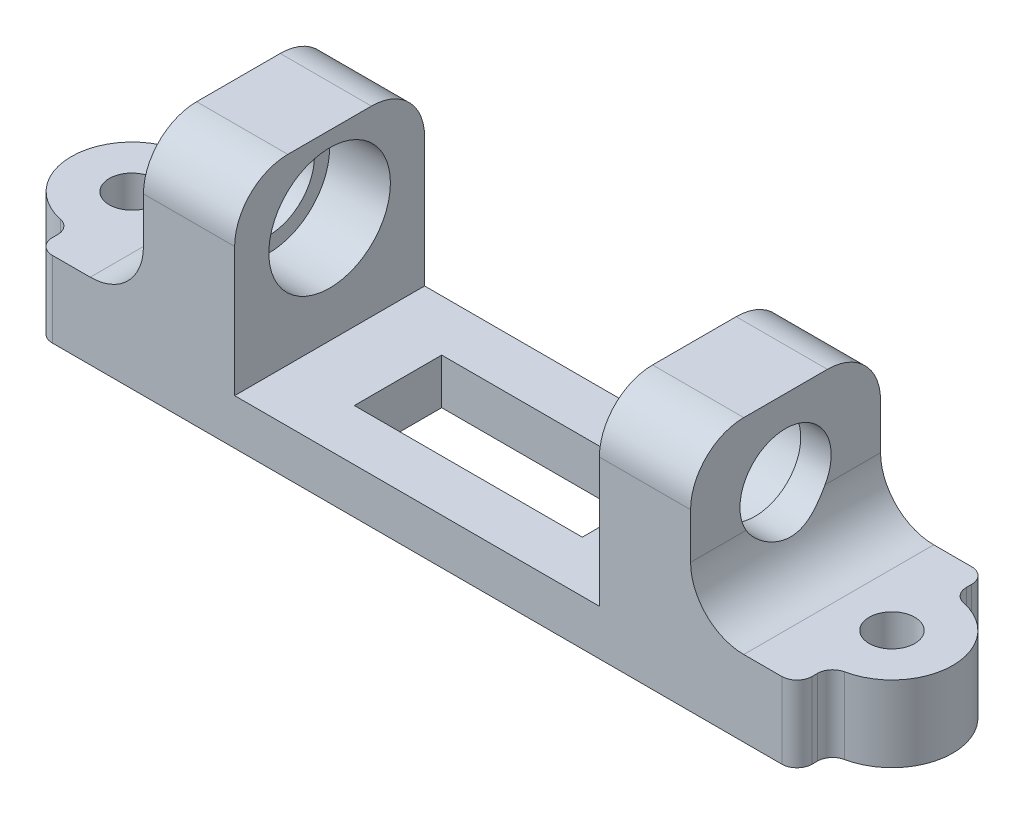
from build123d import *

# Parameters (mm, degrees)
SKETCH1_R           = 1.5
BOSS_EXTRUDE1_DEPTH = 5
BOSS_EXTRUDE2_DEPTH = 10
SKETCH3_R           = 4
CUT_EXTRUDE1_DEPTH  = 4
SKETCH3_3_R         = 3
CUT_EXTRUDE2_DEPTH  = 45.102862719
FILLET6_R           = 3.5
FILLET7_R           = 3.5
FILLET8_R           = 3.5
FILLET9_R           = 3.5
FILLET10_R          = 3.5
FILLET11_R          = 3.5
FILLET12_R          = 1
FILLET13_R          = 1
FILLET14_R          = 1
FILLET15_R          = 1
FILLET16_R          = 1
FILLET17_R          = 1
FILLET18_R          = 1
FILLET19_R          = 1
SKETCH4_W           = 15
SKETCH4_H           = 5.75
CUT_EXTRUDE3_DEPTH  = 32.305949934
SKETCH5_W           = 24
SKETCH5_H           = 12.5
SKETCH5_W_2         = 15
SKETCH5_H_2         = 5.75
CUT_EXTRUDE4_DEPTH  = 2


with BuildPart() as part:
    # Sketch1 → Boss-Extrude1 (new body)
    with BuildSketch(Plane(origin=(0, 0, 0), x_dir=(1, 0, 0), z_dir=(0, 1, 0))):
        with BuildLine():
            Line((-25, -4), (-25, -6.25))
            Line((-25, -6.25), (25, -6.25))
            Line((25, -6.25), (25, -4))
            ThreePointArc((25, -4), (29, 0), (25, 4))
            Line((25, 4), (25, 6.25))
            Line((25, 6.25), (-25, 6.25))
            Line((-25, 6.25), (-25, 4))
            ThreePointArc((-25, 4), (-29, 0), (-25, -4))
        make_face()
        with Locations(Location((25, 0, 0), (0, 0, 270))):
            Circle(SKETCH1_R, mode=Mode.SUBTRACT)
        with Locations(Location((-25, 0, 0), (0, 0, 270))):
            Circle(SKETCH1_R, mode=Mode.SUBTRACT)
    extrude(amount=BOSS_EXTRUDE1_DEPTH)

    # Sketch2 → Boss-Extrude2 (add)
    with BuildSketch(Plane(origin=(0, 5, 0), x_dir=(1, 0, 0), z_dir=(0, 1, 0))):
        Polygon((-18, 0), (-18, -6.25), (-12, -6.25), (-12, 6.25), (-18, 6.25), align=None)
    boss_extrude2 = extrude(amount=BOSS_EXTRUDE2_DEPTH)

    # Sketch3 → Cut-Extrude1 (cut)
    with BuildSketch(Plane(origin=(-12, 0, 0), x_dir=(0, 0, -1), z_dir=(1, 0, 0))):
        with Locations((0, 10)):
            Circle(SKETCH3_R)
    cut_extrude1 = extrude(amount=-CUT_EXTRUDE1_DEPTH, mode=Mode.SUBTRACT)

    # Sketch3<3> → Cut-Extrude2 (cut, through all)
    with BuildSketch(Plane(origin=(-12, 0, 0), x_dir=(0, 0, -1), z_dir=(1, 0, 0))):
        with Locations((0, 10)):
            Circle(SKETCH3_3_R)
    cut_extrude2 = extrude(amount=-CUT_EXTRUDE2_DEPTH, mode=Mode.SUBTRACT)

    # Fillet6
    # the kernel refuses this fillet: 3.5 mm, written as the material it adds along each edge
    with BuildSketch(Plane(origin=(-18, 5, -6.25), x_dir=(0, 1, 0), z_dir=(0, 0, 1))) as fillet6_piece_1_section:
        with BuildLine():
            CenterArc((FILLET6_R, FILLET6_R), FILLET6_R, 180, 90)
            Line((0, FILLET6_R), (0, 0))
            Line((0, 0), (FILLET6_R, 0))
        make_face()
    fillet6_piece_1 = extrude(amount=12.5, mode=Mode.PRIVATE)
    fillet6_piece_1 = fillet6_piece_1 - Plane(origin=(-18.808785758, 10, 0), x_dir=(0, 0, -1), z_dir=(1, 0, 0)) * Cylinder(3, 39, mode=Mode.PRIVATE)
    add(fillet6_piece_1)

    # Fillet7
    fillet7_edges = [part.edges().sort_by_distance(p)[0] for p in [
        (-15, 15, -6.25),
    ]]
    fillet(fillet7_edges, radius=FILLET7_R)

    # Fillet8
    fillet8_edges = [part.edges().sort_by_distance(p)[0] for p in [
        (-15, 15, 6.25),
    ]]
    fillet(fillet8_edges, radius=FILLET8_R)

    # Mirror4: Boss-Extrude2, Cut-Extrude1, Cut-Extrude2 across plane
    add(boss_extrude2.mirror(Plane(origin=(0, 0, 0), x_dir=(0, 0, 1), z_dir=(1, 0, 0))))
    add(cut_extrude1.mirror(Plane(origin=(0, 0, 0), x_dir=(0, 0, 1), z_dir=(1, 0, 0))), mode=Mode.SUBTRACT)
    add(cut_extrude2.mirror(Plane(origin=(0, 0, 0), x_dir=(0, 0, 1), z_dir=(1, 0, 0))), mode=Mode.SUBTRACT)

    # Fillet9
    fillet9_edges = [part.edges().sort_by_distance(p)[0] for p in [
        (15, 15, -6.25),
    ]]
    fillet(fillet9_edges, radius=FILLET9_R)

    # Fillet10
    fillet10_edges = [part.edges().sort_by_distance(p)[0] for p in [
        (15, 15, 6.25),
    ]]
    fillet(fillet10_edges, radius=FILLET10_R)

    # Fillet11
    # the kernel refuses this fillet: 3.5 mm, written as the material it adds along each edge
    with BuildSketch(Plane(origin=(18, 5, -6.25), x_dir=(0, 1, 0), z_dir=(0, 0, 1))) as fillet11_piece_1_section:
        with BuildLine():
            CenterArc((FILLET11_R, -FILLET11_R), FILLET11_R, 90, 90)
            Line((0, -FILLET11_R), (0, 0))
            Line((0, 0), (FILLET11_R, 0))
        make_face()
    fillet11_piece_1 = extrude(amount=12.5, mode=Mode.PRIVATE)
    fillet11_piece_1 = fillet11_piece_1 - Plane(origin=(18.808785758, 10, 0), x_dir=(0, 0, -1), z_dir=(-1, 0, 0)) * Cylinder(3, 39, mode=Mode.PRIVATE)
    add(fillet11_piece_1)

    # Fillet12
    fillet12_edges = [part.edges().sort_by_distance(p)[0] for p in [
        (25, 2.5, -6.25),
    ]]
    fillet(fillet12_edges, radius=FILLET12_R)

    # Fillet13
    fillet13_edges = [part.edges().sort_by_distance(p)[0] for p in [
        (25, 2.5, 6.25),
    ]]
    fillet(fillet13_edges, radius=FILLET13_R)

    # Fillet14
    fillet14_edges = [part.edges().sort_by_distance(p)[0] for p in [
        (-25, 2.5, 6.25),
    ]]
    fillet(fillet14_edges, radius=FILLET14_R)

    # Fillet15
    fillet15_edges = [part.edges().sort_by_distance(p)[0] for p in [
        (-25, 2.5, -6.25),
    ]]
    fillet(fillet15_edges, radius=FILLET15_R)

    # Fillet16
    fillet16_edges = [part.edges().sort_by_distance(p)[0] for p in [
        (-25, 2.5, -4),
    ]]
    fillet(fillet16_edges, radius=FILLET16_R)

    # Fillet17
    fillet17_edges = [part.edges().sort_by_distance(p)[0] for p in [
        (-25, 2.5, 4),
    ]]
    fillet(fillet17_edges, radius=FILLET17_R)

    # Fillet18
    fillet18_edges = [part.edges().sort_by_distance(p)[0] for p in [
        (25, 2.5, 4),
    ]]
    fillet(fillet18_edges, radius=FILLET18_R)

    # Fillet19
    fillet19_edges = [part.edges().sort_by_distance(p)[0] for p in [
        (25, 2.5, -4),
    ]]
    fillet(fillet19_edges, radius=FILLET19_R)

    # Sketch4 → Cut-Extrude3 (cut, through all)
    with BuildSketch(Plane(origin=(0, 5, 0), x_dir=(1, 0, 0), z_dir=(0, 1, 0))):
        Rectangle(SKETCH4_W, SKETCH4_H)
    extrude(amount=-CUT_EXTRUDE3_DEPTH, mode=Mode.SUBTRACT)

    # Sketch5 → Cut-Extrude4 (cut)
    with BuildSketch(Plane(origin=(0, 5, 0), x_dir=(1, 0, 0), z_dir=(0, 1, 0))):
        Rectangle(SKETCH5_W, SKETCH5_H)
        Rectangle(SKETCH5_W_2, SKETCH5_H_2, mode=Mode.SUBTRACT)
    extrude(amount=-CUT_EXTRUDE4_DEPTH, mode=Mode.SUBTRACT)


solid = part.part
